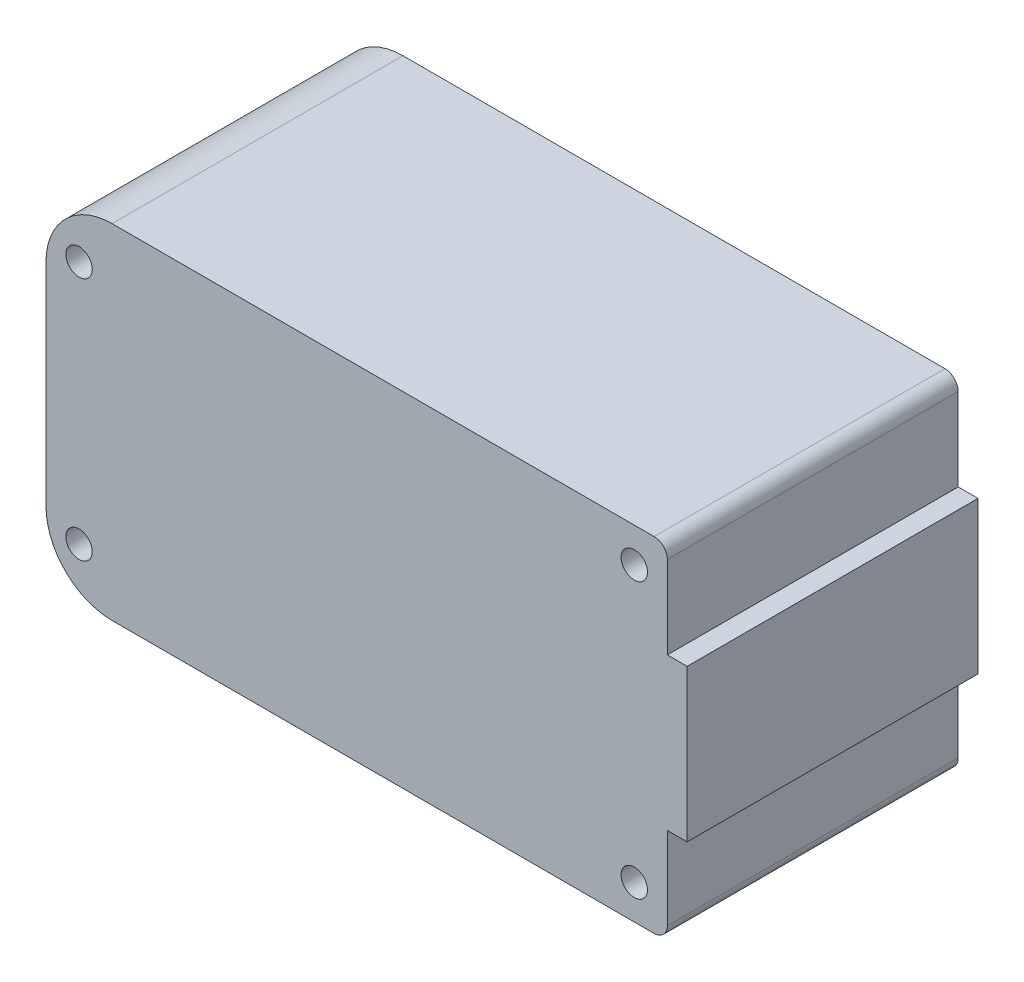
from build123d import *

# Parameters (mm, degrees)
SKETCH1_R           = 1
BOSS_EXTRUDE1_DEPTH = 11
FILLET1_R           = 5
FILLET2_R           = 1


with BuildPart() as part:
    # Sketch1 → Boss-Extrude1 (new, symmetric)
    with BuildSketch(Plane.XY):
        Polygon((35.5, -13), (-11.5, -13), (-11.5, 13), (35.5, 13), (35.5, 5.75), (37, 5.75), (37, -5.75), (35.5, -5.75), align=None)
        with Locations((-9, 9.25)):
            Circle(SKETCH1_R, mode=Mode.SUBTRACT)
        with Locations((33, 10.4)):
            Circle(SKETCH1_R, mode=Mode.SUBTRACT)
        with Locations((33, -10.4)):
            Circle(SKETCH1_R, mode=Mode.SUBTRACT)
        with Locations((-9, -9.25)):
            Circle(SKETCH1_R, mode=Mode.SUBTRACT)
    extrude(amount=BOSS_EXTRUDE1_DEPTH, both=True)

    # Fillet1
    fillet1_edges = [part.edges().sort_by_distance(p)[0] for p in [
        (-11.5, 13, 0),
        (-11.5, -13, 0),
    ]]
    fillet(fillet1_edges, radius=FILLET1_R)

    # Fillet2
    fillet2_edges = [part.edges().sort_by_distance(p)[0] for p in [
        (35.5, 13, 0),
        (35.5, -13, 0),
    ]]
    fillet(fillet2_edges, radius=FILLET2_R)


solid = part.part
